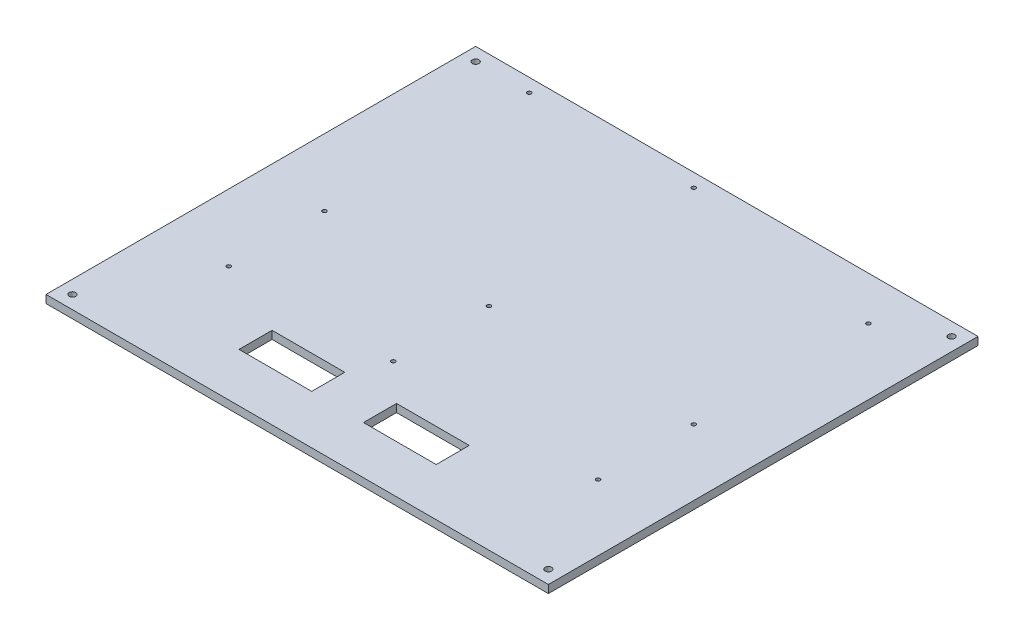
from build123d import *

# Parameters (mm, degrees)
BASE_PLATE_W        = 380
BASE_PLATE_H        = 325
BASE_PLATE_R        = 1.5
BASE_PLATE_R_2      = 2.5
BASE_PLATE_W_2      = 55
BASE_PLATE_H_2      = 25
BOSS_EXTRUDE1_DEPTH = 6


with BuildPart() as part:
    # Base Plate → Boss-Extrude1 (new body)
    with BuildSketch(Plane(origin=(0, 0, 0), x_dir=(1, 0, 0), z_dir=(0, 1, 0))):
        Rectangle(BASE_PLATE_W, BASE_PLATE_H)
        with Locations((-139.29, -74.99)):
            Circle(BASE_PLATE_R, mode=Mode.SUBTRACT)
        with Locations((-14.83, -2.6)):
            Circle(BASE_PLATE_R, mode=Mode.SUBTRACT)
        with Locations((-139.29, -2.6)):
            Circle(BASE_PLATE_R, mode=Mode.SUBTRACT)
        with Locations((-139.29, 152.34)):
            Circle(BASE_PLATE_R, mode=Mode.SUBTRACT)
        with Locations((-14.83, 152.34)):
            Circle(BASE_PLATE_R, mode=Mode.SUBTRACT)
        with Locations((-14.83, -74.99)):
            Circle(BASE_PLATE_R, mode=Mode.SUBTRACT)
        with Locations((140.11, -74.99)):
            Circle(BASE_PLATE_R, mode=Mode.SUBTRACT)
        with Locations((140.11, -2.6)):
            Circle(BASE_PLATE_R, mode=Mode.SUBTRACT)
        with Locations((140.11, 129.48)):
            Circle(BASE_PLATE_R, mode=Mode.SUBTRACT)
        with Locations((-180, -152.5)):
            Circle(BASE_PLATE_R_2, mode=Mode.SUBTRACT)
        with Locations((180, -152.5)):
            Circle(BASE_PLATE_R_2, mode=Mode.SUBTRACT)
        with Locations((-180, 152.5)):
            Circle(BASE_PLATE_R_2, mode=Mode.SUBTRACT)
        with Locations((180, 152.5)):
            Circle(BASE_PLATE_R_2, mode=Mode.SUBTRACT)
        with Locations((41.5, -113.84)):
            Rectangle(BASE_PLATE_W_2, BASE_PLATE_H_2, mode=Mode.SUBTRACT)
        with Locations((-53.5, -113)):
            Rectangle(BASE_PLATE_W_2, BASE_PLATE_H_2, mode=Mode.SUBTRACT)
    extrude(amount=BOSS_EXTRUDE1_DEPTH)


solid = part.part
